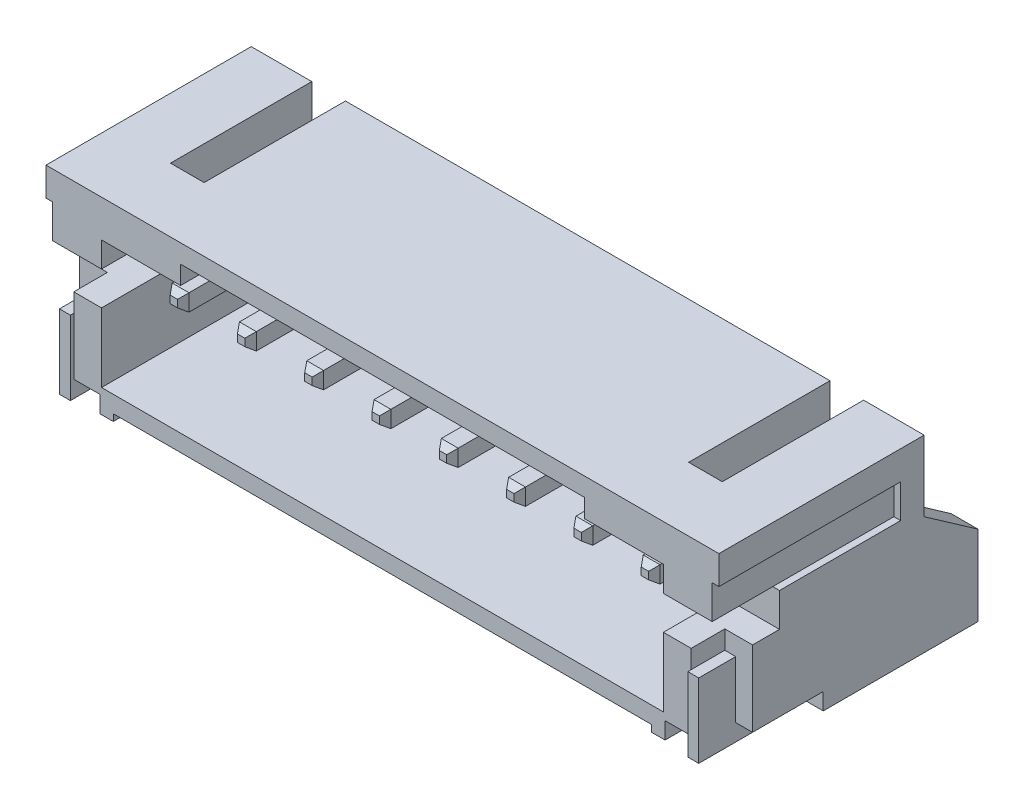
from build123d import *
from OCP.BRepFilletAPI import BRepFilletAPI_MakeChamfer

# Parameters (mm, degrees)
SKETCH_1_W           = 20
SKETCH_1_H           = 5.6
EXTRUDE_1_DEPTH      = 4.8
SKETCH_2_W           = 20
SKETCH_2_H           = 5.6
EXTRUDE_2_DEPTH      = 1.3
SKETCH_3_W           = 0.5
SKETCH_3_H           = 3.439407172
EXTRUDE_3_DEPTH      = 0.5
SKETCH_4_W           = 0.5
SKETCH_4_H           = 0.5
EXTRUDE_4_DEPTH      = 2.2
SKETCH_5_W           = 0.8
SKETCH_5_H           = 3.5
EXTRUDE_5_DEPTH      = 1.6
CHAMFER_1_SIZE       = 1.120332061
CHAMFER_1_SIZE_2     = 1.6
SKETCH_6_W           = 18.4
SKETCH_6_H           = 2
SKETCH_6_W_2         = 3.6
SKETCH_6_H_2         = 1
CUT_EXTRUDE_1_DEPTH  = 0.8
SKETCH_7_W           = 1
SKETCH_7_H           = 1.1
CUT_EXTRUDE_2_DEPTH  = 4.2
SKETCH_8_W           = 0.2
SKETCH_8_H           = 1
CUT_EXTRUDE_3_DEPTH  = 5.4
SKETCH_9_W           = 1.65
SKETCH_9_H           = 1
CUT_EXTRUDE_4_DEPTH  = 1.8
CUT_EXTRUDE_5_DEPTH  = 1
SKETCH_11_W          = 0.5
SKETCH_11_H          = 0.5
CUT_EXTRUDE_6_DEPTH  = 2.1
SKETCH_12_W          = 0.325
SKETCH_12_H          = 2.2
EXTRUDE_6_DEPTH      = 1.1
SKETCH_13_W          = 0.2
SKETCH_13_H          = 2.1
CUT_EXTRUDE_7_DEPTH  = 0.2
SKETCH_14_W          = 0.5
SKETCH_14_H          = 0.5
EXTRUDE_7_DEPTH      = 4
CHAMFER_2_SIZE       = 0.2
CHAMFER_2_SIZE2      = 0.140041508
FILLET_1_R           = 0.4
SKETCH_15_W          = 16
SKETCH_15_H          = 6.1
CUT_EXTRUDE_11_DEPTH = 0.2
FILLET_2_R           = 0.4


# Some blends are built 0.0001 mm under size
with BuildPart() as part:
    # Эскиз1 → Бобышка-Вытянуть1 (new body)
    with BuildSketch(Plane.XY):
        with Locations((0, -0.639407172)):
            Rectangle(SKETCH_1_W, SKETCH_1_H)
        Polygon((-6, 1.610592828), (6, 1.610592828), (6, 1.060592828), (8.35, 1.060592828), (8.35, -2.739407172), (-8.35, -2.739407172), (-8.35, 1.060592828), (-6, 1.060592828), align=None, mode=Mode.SUBTRACT)
    extrude(amount=EXTRUDE_1_DEPTH)

    # Эскиз2 → Бобышка-Вытянуть2 (add)
    with BuildSketch(Plane(origin=(0, 0, 0), x_dir=(-1, 0, 0), z_dir=(0, 0, -1))):
        with Locations((0, -0.639407172)):
            Rectangle(SKETCH_2_W, SKETCH_2_H)
    extrude(amount=EXTRUDE_2_DEPTH)

    # Эскиз3 → Бобышка-Вытянуть3 (add)
    with BuildSketch(Plane(origin=(0, 0, -1.3), x_dir=(-1, 0, 0), z_dir=(0, 0, -1))):
        with Locations((1, -1.719703586)):
            Rectangle(SKETCH_3_W, SKETCH_3_H)
        with Locations((3, -1.719703586)):
            Rectangle(SKETCH_3_W, SKETCH_3_H)
        with Locations((5, -1.719703586)):
            Rectangle(SKETCH_3_W, SKETCH_3_H)
        with Locations((7, -1.719703586)):
            Rectangle(SKETCH_3_W, SKETCH_3_H)
        with Locations((-7, -1.719703586)):
            Rectangle(SKETCH_3_W, SKETCH_3_H)
        with Locations((-5, -1.719703586)):
            Rectangle(SKETCH_3_W, SKETCH_3_H)
        with Locations((-3, -1.719703586)):
            Rectangle(SKETCH_3_W, SKETCH_3_H)
        with Locations((-1, -1.719703586)):
            Rectangle(SKETCH_3_W, SKETCH_3_H)
    extrude(amount=EXTRUDE_3_DEPTH)

    # Эскиз4 → Бобышка-Вытянуть4 (add)
    with BuildSketch(Plane(origin=(0, 0, -1.8), x_dir=(-1, 0, 0), z_dir=(0, 0, -1))):
        with Locations((-7, -3.189407172)):
            Rectangle(SKETCH_4_W, SKETCH_4_H)
        with Locations((-5, -3.189407172)):
            Rectangle(SKETCH_4_W, SKETCH_4_H)
        with Locations((-3, -3.189407172)):
            Rectangle(SKETCH_4_W, SKETCH_4_H)
        with Locations((-1, -3.189407172)):
            Rectangle(SKETCH_4_W, SKETCH_4_H)
        with Locations((1, -3.189407172)):
            Rectangle(SKETCH_4_W, SKETCH_4_H)
        with Locations((3, -3.189407172)):
            Rectangle(SKETCH_4_W, SKETCH_4_H)
        with Locations((5, -3.189407172)):
            Rectangle(SKETCH_4_W, SKETCH_4_H)
        with Locations((7, -3.189407172)):
            Rectangle(SKETCH_4_W, SKETCH_4_H)
    extrude(amount=EXTRUDE_4_DEPTH)

    # Эскиз5 → Бобышка-Вытянуть5 (add)
    with BuildSketch(Plane(origin=(0, 0, -1.3), x_dir=(-1, 0, 0), z_dir=(0, 0, -1))):
        with Locations((-9.6, -1.689407172)):
            Rectangle(SKETCH_5_W, SKETCH_5_H)
        with Locations((9.6, -1.689407172)):
            Rectangle(SKETCH_5_W, SKETCH_5_H)
    extrude(amount=EXTRUDE_5_DEPTH)

    # Фаска1
    chamfer_1_edges_1 = [part.edges().sort_by_distance(p)[0] for p in [
        (-9.6, 0.060592828, -2.9),
    ]]
    chamfer_1_side_1 = [part.faces().sort_by_distance(p)[0] for p in [
        (-9.6, 0.038186187, -2.9),
    ]]
    chamfer_1_edges_2 = [part.edges().sort_by_distance(p)[0] for p in [
        (9.6, 0.060592828, -2.9),
    ]]
    chamfer_1_side_2 = [part.faces().sort_by_distance(p)[0] for p in [
        (9.6, 0.038186187, -2.9),
    ]]
    chamfer_1 = BRepFilletAPI_MakeChamfer(part.part.solid().wrapped)
    for e in chamfer_1_edges_1:
        chamfer_1.Add(CHAMFER_1_SIZE - 0.0001, CHAMFER_1_SIZE_2 - 0.0001, e.wrapped, chamfer_1_side_1[0].wrapped)
    for e in chamfer_1_edges_2:
        chamfer_1.Add(CHAMFER_1_SIZE - 0.0001, CHAMFER_1_SIZE_2 - 0.0001, e.wrapped, chamfer_1_side_2[0].wrapped)
    add(Compound.cast(chamfer_1.Shape()), mode=Mode.REPLACE)  # a hair under: the kernel refuses the full size

    # Эскиз6 → Вырез-Вытянуть1 (cut)
    with BuildSketch(Plane(origin=(0, 0, -1.3), x_dir=(-1, 0, 0), z_dir=(0, 0, -1))):
        with Locations((0, -1.839407172)):
            Rectangle(SKETCH_6_W, SKETCH_6_H)
        with Locations((0, 1.110592828)):
            Rectangle(SKETCH_6_W_2, SKETCH_6_H_2)
    extrude(amount=-CUT_EXTRUDE_1_DEPTH, mode=Mode.SUBTRACT)

    # Эскиз7 → Вырез-Вытянуть2 (cut)
    with BuildSketch(Plane(origin=(0, 0, -1.3), x_dir=(-1, 0, 0), z_dir=(0, 0, -1))):
        with Locations((7.7, 1.610592828)):
            Rectangle(SKETCH_7_W, SKETCH_7_H)
        with Locations((-7.7, 1.610592828)):
            Rectangle(SKETCH_7_W, SKETCH_7_H)
    extrude(amount=-CUT_EXTRUDE_2_DEPTH, mode=Mode.SUBTRACT)

    # Эскиз8 → Вырез-Вытянуть3 (cut)
    with BuildSketch(Plane.XY.offset(4.8)):
        with Locations((9.9, 0.810592828)):
            Rectangle(SKETCH_8_W, SKETCH_8_H)
        with Locations((-9.9, 0.810592828)):
            Rectangle(SKETCH_8_W, SKETCH_8_H)
    extrude(amount=-CUT_EXTRUDE_3_DEPTH, mode=Mode.SUBTRACT)

    # Эскиз9 → Вырез-Вытянуть4 (cut)
    with BuildSketch(Plane.XY.offset(4.8)):
        with Locations((-9.175, -0.189407172)):
            Rectangle(SKETCH_9_W, SKETCH_9_H)
        with Locations((9.175, -0.189407172)):
            Rectangle(SKETCH_9_W, SKETCH_9_H)
    extrude(amount=-CUT_EXTRUDE_4_DEPTH, mode=Mode.SUBTRACT)

    # Эскиз10 → Вырез-Вытянуть5 (cut)
    with BuildSketch(Plane.XY.offset(4.8)):
        Polygon((-10, -0.689407172), (-9.175, -0.689407172), (-9.175, -2.939407172), (-8.4, -2.939407172), (-8.4, -3.439407172), (-9.2, -3.439407172), (-10, -3.439407172), align=None)
        Polygon((10, -0.689407172), (10, -3.439407172), (9.2, -3.439407172), (8.4, -3.439407172), (8.4, -2.939407172), (9.175, -2.939407172), (9.175, -0.689407172), align=None)
    extrude(amount=-CUT_EXTRUDE_5_DEPTH, mode=Mode.SUBTRACT)

    # Эскиз11 → Вырез-Вытянуть6 (cut)
    with BuildSketch(Plane.XY.offset(3.8)):
        with Locations((-9.75, -3.189407172)):
            Rectangle(SKETCH_11_W, SKETCH_11_H)
        with Locations((9.75, -3.189407172)):
            Rectangle(SKETCH_11_W, SKETCH_11_H)
    extrude(amount=-CUT_EXTRUDE_6_DEPTH, mode=Mode.SUBTRACT)

    # Эскиз12 → Бобышка-Вытянуть6 (add)
    with BuildSketch(Plane.XY.offset(3.8)):
        with Locations((-9.3375, -2.339407172)):
            Rectangle(SKETCH_12_W, SKETCH_12_H)
        with Locations((9.3375, -2.339407172)):
            Rectangle(SKETCH_12_W, SKETCH_12_H)
    extrude(amount=EXTRUDE_6_DEPTH)

    # Эскиз13 → Вырез-Вытянуть7 (cut)
    with BuildSketch(Plane.XZ.offset(3.439407172)):
        with Locations((-9.075, 2.75)):
            Rectangle(SKETCH_13_W, SKETCH_13_H)
        with Locations((9.075, 2.75)):
            Rectangle(SKETCH_13_W, SKETCH_13_H)
    extrude(amount=-CUT_EXTRUDE_7_DEPTH, mode=Mode.SUBTRACT)

    # Эскиз14 → Бобышка-Вытянуть7 (add)
    with BuildSketch(Plane.XY):
        with Locations((7, -0.25)):
            Rectangle(SKETCH_14_W, SKETCH_14_H)
        with Locations((5, -0.25)):
            Rectangle(SKETCH_14_W, SKETCH_14_H)
        with Locations((3, -0.25)):
            Rectangle(SKETCH_14_W, SKETCH_14_H)
        with Locations((1, -0.25)):
            Rectangle(SKETCH_14_W, SKETCH_14_H)
        with Locations((-1, -0.25)):
            Rectangle(SKETCH_14_W, SKETCH_14_H)
        with Locations((-3, -0.25)):
            Rectangle(SKETCH_14_W, SKETCH_14_H)
        with Locations((-5, -0.25)):
            Rectangle(SKETCH_14_W, SKETCH_14_H)
        with Locations((-7, -0.25)):
            Rectangle(SKETCH_14_W, SKETCH_14_H)
    extrude(amount=EXTRUDE_7_DEPTH)

    # Фаска2: one chamfer whose edges measure the first distance from different faces: ONE call of the kernel's chamfer builder (chamfer() names one face for all edges)
    chamfer_2_edges_1 = [part.edges().sort_by_distance(p)[0] for p in [
        (7.25, -3.189407172, -4),
    ]]
    chamfer_2_side_1 = [part.faces().sort_by_distance(p)[0] for p in [
        (7.25, -3.395681296, -2.65),
    ]]
    chamfer_2_edges_2 = [part.edges().sort_by_distance(p)[0] for p in [
        (7, -3.439407172, -4),
        (5, -3.439407172, -4),
        (3, -3.439407172, -4),
        (1, -3.439407172, -4),
        (-1, -3.439407172, -4),
        (-3, -3.439407172, -4),
        (-5, -3.439407172, -4),
        (-7, -3.439407172, -4),
    ]]
    chamfer_2_side_2 = [part.faces().sort_by_distance(p)[0] for p in [
        (0, -3.439407172, 1.237305191),
    ]]
    chamfer_2_edges_3 = [part.edges().sort_by_distance(p)[0] for p in [
        (6.75, -3.189407172, -4),
    ]]
    chamfer_2_side_3 = [part.faces().sort_by_distance(p)[0] for p in [
        (6.75, -0.043725875, -1.55),
    ]]
    chamfer_2_edges_4 = [part.edges().sort_by_distance(p)[0] for p in [
        (7, -2.939407172, -4),
    ]]
    chamfer_2_side_4 = [part.faces().sort_by_distance(p)[0] for p in [
        (7, -2.939407172, -2.9),
    ]]
    chamfer_2_edges_5 = [part.edges().sort_by_distance(p)[0] for p in [
        (4.75, -3.189407172, -4),
    ]]
    chamfer_2_side_5 = [part.faces().sort_by_distance(p)[0] for p in [
        (4.75, -0.043725875, -1.55),
    ]]
    chamfer_2_edges_6 = [part.edges().sort_by_distance(p)[0] for p in [
        (5, -2.939407172, -4),
    ]]
    chamfer_2_side_6 = [part.faces().sort_by_distance(p)[0] for p in [
        (5, -2.939407172, -2.9),
    ]]
    chamfer_2_edges_7 = [part.edges().sort_by_distance(p)[0] for p in [
        (5.25, -3.189407172, -4),
    ]]
    chamfer_2_side_7 = [part.faces().sort_by_distance(p)[0] for p in [
        (5.25, -3.395681296, -2.65),
    ]]
    chamfer_2_edges_8 = [part.edges().sort_by_distance(p)[0] for p in [
        (2.75, -3.189407172, -4),
    ]]
    chamfer_2_side_8 = [part.faces().sort_by_distance(p)[0] for p in [
        (2.75, -0.043725875, -1.55),
    ]]
    chamfer_2_edges_9 = [part.edges().sort_by_distance(p)[0] for p in [
        (3, -2.939407172, -4),
    ]]
    chamfer_2_side_9 = [part.faces().sort_by_distance(p)[0] for p in [
        (3, -2.939407172, -2.9),
    ]]
    chamfer_2_edges_10 = [part.edges().sort_by_distance(p)[0] for p in [
        (3.25, -3.189407172, -4),
    ]]
    chamfer_2_side_10 = [part.faces().sort_by_distance(p)[0] for p in [
        (3.25, -3.395681296, -2.65),
    ]]
    chamfer_2_edges_11 = [part.edges().sort_by_distance(p)[0] for p in [
        (0.75, -3.189407172, -4),
    ]]
    chamfer_2_side_11 = [part.faces().sort_by_distance(p)[0] for p in [
        (0.75, -3.395681296, -2.65),
    ]]
    chamfer_2_edges_12 = [part.edges().sort_by_distance(p)[0] for p in [
        (1, -2.939407172, -4),
    ]]
    chamfer_2_side_12 = [part.faces().sort_by_distance(p)[0] for p in [
        (1, -2.939407172, -2.9),
    ]]
    chamfer_2_edges_13 = [part.edges().sort_by_distance(p)[0] for p in [
        (1.25, -3.189407172, -4),
    ]]
    chamfer_2_side_13 = [part.faces().sort_by_distance(p)[0] for p in [
        (1.25, -0.043725875, -1.55),
    ]]
    chamfer_2_edges_14 = [part.edges().sort_by_distance(p)[0] for p in [
        (-1.25, -3.189407172, -4),
    ]]
    chamfer_2_side_14 = [part.faces().sort_by_distance(p)[0] for p in [
        (-1.25, -0.043725875, -1.55),
    ]]
    chamfer_2_edges_15 = [part.edges().sort_by_distance(p)[0] for p in [
        (-1, -2.939407172, -4),
    ]]
    chamfer_2_side_15 = [part.faces().sort_by_distance(p)[0] for p in [
        (-1, -2.939407172, -2.9),
    ]]
    chamfer_2_edges_16 = [part.edges().sort_by_distance(p)[0] for p in [
        (-0.75, -3.189407172, -4),
    ]]
    chamfer_2_side_16 = [part.faces().sort_by_distance(p)[0] for p in [
        (-0.75, -3.395681296, -2.65),
    ]]
    chamfer_2_edges_17 = [part.edges().sort_by_distance(p)[0] for p in [
        (-3.25, -3.189407172, -4),
    ]]
    chamfer_2_side_17 = [part.faces().sort_by_distance(p)[0] for p in [
        (-3.25, -3.395681296, -2.65),
    ]]
    chamfer_2_edges_18 = [part.edges().sort_by_distance(p)[0] for p in [
        (-3, -2.939407172, -4),
    ]]
    chamfer_2_side_18 = [part.faces().sort_by_distance(p)[0] for p in [
        (-3, -2.939407172, -2.9),
    ]]
    chamfer_2_edges_19 = [part.edges().sort_by_distance(p)[0] for p in [
        (-2.75, -3.189407172, -4),
    ]]
    chamfer_2_side_19 = [part.faces().sort_by_distance(p)[0] for p in [
        (-2.75, -0.043725875, -1.55),
    ]]
    chamfer_2_edges_20 = [part.edges().sort_by_distance(p)[0] for p in [
        (-5.25, -3.189407172, -4),
    ]]
    chamfer_2_side_20 = [part.faces().sort_by_distance(p)[0] for p in [
        (-5.25, -3.395681296, -2.65),
    ]]
    chamfer_2_edges_21 = [part.edges().sort_by_distance(p)[0] for p in [
        (-5, -2.939407172, -4),
    ]]
    chamfer_2_side_21 = [part.faces().sort_by_distance(p)[0] for p in [
        (-5, -2.939407172, -2.9),
    ]]
    chamfer_2_edges_22 = [part.edges().sort_by_distance(p)[0] for p in [
        (-4.75, -3.189407172, -4),
    ]]
    chamfer_2_side_22 = [part.faces().sort_by_distance(p)[0] for p in [
        (-4.75, -0.043725875, -1.55),
    ]]
    chamfer_2_edges_23 = [part.edges().sort_by_distance(p)[0] for p in [
        (-7.25, -3.189407172, -4),
    ]]
    chamfer_2_side_23 = [part.faces().sort_by_distance(p)[0] for p in [
        (-7.25, -3.395681296, -2.65),
    ]]
    chamfer_2_edges_24 = [part.edges().sort_by_distance(p)[0] for p in [
        (-7, -2.939407172, -4),
    ]]
    chamfer_2_side_24 = [part.faces().sort_by_distance(p)[0] for p in [
        (-7, -2.939407172, -2.9),
    ]]
    chamfer_2_edges_25 = [part.edges().sort_by_distance(p)[0] for p in [
        (-6.75, -3.189407172, -4),
    ]]
    chamfer_2_side_25 = [part.faces().sort_by_distance(p)[0] for p in [
        (-6.75, -0.043725875, -1.55),
    ]]
    chamfer_2_edges_26 = [part.edges().sort_by_distance(p)[0] for p in [
        (7.25, -0.25, 4),
    ]]
    chamfer_2_side_26 = [part.faces().sort_by_distance(p)[0] for p in [
        (7.25, -0.25, 2),
    ]]
    chamfer_2_edges_27 = [part.edges().sort_by_distance(p)[0] for p in [
        (7, 0, 4),
    ]]
    chamfer_2_side_27 = [part.faces().sort_by_distance(p)[0] for p in [
        (7, 0, 2),
    ]]
    chamfer_2_edges_28 = [part.edges().sort_by_distance(p)[0] for p in [
        (6.75, -0.25, 4),
    ]]
    chamfer_2_side_28 = [part.faces().sort_by_distance(p)[0] for p in [
        (6.75, -0.25, 2),
    ]]
    chamfer_2_edges_29 = [part.edges().sort_by_distance(p)[0] for p in [
        (7, -0.5, 4),
    ]]
    chamfer_2_side_29 = [part.faces().sort_by_distance(p)[0] for p in [
        (7, -0.5, 2),
    ]]
    chamfer_2_edges_30 = [part.edges().sort_by_distance(p)[0] for p in [
        (5.25, -0.25, 4),
    ]]
    chamfer_2_side_30 = [part.faces().sort_by_distance(p)[0] for p in [
        (5.25, -0.25, 2),
    ]]
    chamfer_2_edges_31 = [part.edges().sort_by_distance(p)[0] for p in [
        (5, 0, 4),
    ]]
    chamfer_2_side_31 = [part.faces().sort_by_distance(p)[0] for p in [
        (5, 0, 2),
    ]]
    chamfer_2_edges_32 = [part.edges().sort_by_distance(p)[0] for p in [
        (4.75, -0.25, 4),
    ]]
    chamfer_2_side_32 = [part.faces().sort_by_distance(p)[0] for p in [
        (4.75, -0.25, 2),
    ]]
    chamfer_2_edges_33 = [part.edges().sort_by_distance(p)[0] for p in [
        (5, -0.5, 4),
    ]]
    chamfer_2_side_33 = [part.faces().sort_by_distance(p)[0] for p in [
        (5, -0.5, 2),
    ]]
    chamfer_2_edges_34 = [part.edges().sort_by_distance(p)[0] for p in [
        (3.25, -0.25, 4),
    ]]
    chamfer_2_side_34 = [part.faces().sort_by_distance(p)[0] for p in [
        (3.25, -0.25, 2),
    ]]
    chamfer_2_edges_35 = [part.edges().sort_by_distance(p)[0] for p in [
        (3, 0, 4),
    ]]
    chamfer_2_side_35 = [part.faces().sort_by_distance(p)[0] for p in [
        (3, 0, 2),
    ]]
    chamfer_2_edges_36 = [part.edges().sort_by_distance(p)[0] for p in [
        (2.75, -0.25, 4),
    ]]
    chamfer_2_side_36 = [part.faces().sort_by_distance(p)[0] for p in [
        (2.75, -0.25, 2),
    ]]
    chamfer_2_edges_37 = [part.edges().sort_by_distance(p)[0] for p in [
        (3, -0.5, 4),
    ]]
    chamfer_2_side_37 = [part.faces().sort_by_distance(p)[0] for p in [
        (3, -0.5, 2),
    ]]
    chamfer_2_edges_38 = [part.edges().sort_by_distance(p)[0] for p in [
        (1.25, -0.25, 4),
    ]]
    chamfer_2_side_38 = [part.faces().sort_by_distance(p)[0] for p in [
        (1.25, -0.25, 2),
    ]]
    chamfer_2_edges_39 = [part.edges().sort_by_distance(p)[0] for p in [
        (1, 0, 4),
    ]]
    chamfer_2_side_39 = [part.faces().sort_by_distance(p)[0] for p in [
        (1, 0, 2),
    ]]
    chamfer_2_edges_40 = [part.edges().sort_by_distance(p)[0] for p in [
        (0.75, -0.25, 4),
    ]]
    chamfer_2_side_40 = [part.faces().sort_by_distance(p)[0] for p in [
        (0.75, -0.25, 2),
    ]]
    chamfer_2_edges_41 = [part.edges().sort_by_distance(p)[0] for p in [
        (1, -0.5, 4),
    ]]
    chamfer_2_side_41 = [part.faces().sort_by_distance(p)[0] for p in [
        (1, -0.5, 2),
    ]]
    chamfer_2_edges_42 = [part.edges().sort_by_distance(p)[0] for p in [
        (-0.75, -0.25, 4),
    ]]
    chamfer_2_side_42 = [part.faces().sort_by_distance(p)[0] for p in [
        (-0.75, -0.25, 2),
    ]]
    chamfer_2_edges_43 = [part.edges().sort_by_distance(p)[0] for p in [
        (-1, 0, 4),
    ]]
    chamfer_2_side_43 = [part.faces().sort_by_distance(p)[0] for p in [
        (-1, 0, 2),
    ]]
    chamfer_2_edges_44 = [part.edges().sort_by_distance(p)[0] for p in [
        (-1.25, -0.25, 4),
    ]]
    chamfer_2_side_44 = [part.faces().sort_by_distance(p)[0] for p in [
        (-1.25, -0.25, 2),
    ]]
    chamfer_2_edges_45 = [part.edges().sort_by_distance(p)[0] for p in [
        (-1, -0.5, 4),
    ]]
    chamfer_2_side_45 = [part.faces().sort_by_distance(p)[0] for p in [
        (-1, -0.5, 2),
    ]]
    chamfer_2_edges_46 = [part.edges().sort_by_distance(p)[0] for p in [
        (-2.75, -0.25, 4),
    ]]
    chamfer_2_side_46 = [part.faces().sort_by_distance(p)[0] for p in [
        (-2.75, -0.25, 2),
    ]]
    chamfer_2_edges_47 = [part.edges().sort_by_distance(p)[0] for p in [
        (-3, 0, 4),
    ]]
    chamfer_2_side_47 = [part.faces().sort_by_distance(p)[0] for p in [
        (-3, 0, 2),
    ]]
    chamfer_2_edges_48 = [part.edges().sort_by_distance(p)[0] for p in [
        (-3.25, -0.25, 4),
    ]]
    chamfer_2_side_48 = [part.faces().sort_by_distance(p)[0] for p in [
        (-3.25, -0.25, 2),
    ]]
    chamfer_2_edges_49 = [part.edges().sort_by_distance(p)[0] for p in [
        (-3, -0.5, 4),
    ]]
    chamfer_2_side_49 = [part.faces().sort_by_distance(p)[0] for p in [
        (-3, -0.5, 2),
    ]]
    chamfer_2_edges_50 = [part.edges().sort_by_distance(p)[0] for p in [
        (-4.75, -0.25, 4),
    ]]
    chamfer_2_side_50 = [part.faces().sort_by_distance(p)[0] for p in [
        (-4.75, -0.25, 2),
    ]]
    chamfer_2_edges_51 = [part.edges().sort_by_distance(p)[0] for p in [
        (-5, 0, 4),
    ]]
    chamfer_2_side_51 = [part.faces().sort_by_distance(p)[0] for p in [
        (-5, 0, 2),
    ]]
    chamfer_2_edges_52 = [part.edges().sort_by_distance(p)[0] for p in [
        (-5.25, -0.25, 4),
    ]]
    chamfer_2_side_52 = [part.faces().sort_by_distance(p)[0] for p in [
        (-5.25, -0.25, 2),
    ]]
    chamfer_2_edges_53 = [part.edges().sort_by_distance(p)[0] for p in [
        (-5, -0.5, 4),
    ]]
    chamfer_2_side_53 = [part.faces().sort_by_distance(p)[0] for p in [
        (-5, -0.5, 2),
    ]]
    chamfer_2_edges_54 = [part.edges().sort_by_distance(p)[0] for p in [
        (-6.75, -0.25, 4),
    ]]
    chamfer_2_side_54 = [part.faces().sort_by_distance(p)[0] for p in [
        (-6.75, -0.25, 2),
    ]]
    chamfer_2_edges_55 = [part.edges().sort_by_distance(p)[0] for p in [
        (-7, 0, 4),
    ]]
    chamfer_2_side_55 = [part.faces().sort_by_distance(p)[0] for p in [
        (-7, 0, 2),
    ]]
    chamfer_2_edges_56 = [part.edges().sort_by_distance(p)[0] for p in [
        (-7.25, -0.25, 4),
    ]]
    chamfer_2_side_56 = [part.faces().sort_by_distance(p)[0] for p in [
        (-7.25, -0.25, 2),
    ]]
    chamfer_2_edges_57 = [part.edges().sort_by_distance(p)[0] for p in [
        (-7, -0.5, 4),
    ]]
    chamfer_2_side_57 = [part.faces().sort_by_distance(p)[0] for p in [
        (-7, -0.5, 2),
    ]]
    chamfer_2 = BRepFilletAPI_MakeChamfer(part.part.solid().wrapped)
    for e in chamfer_2_edges_1:
        chamfer_2.Add(CHAMFER_2_SIZE, CHAMFER_2_SIZE2, e.wrapped, chamfer_2_side_1[0].wrapped)  # the first distance lies on this face
    for e in chamfer_2_edges_2:
        chamfer_2.Add(CHAMFER_2_SIZE, CHAMFER_2_SIZE2, e.wrapped, chamfer_2_side_2[0].wrapped)  # the first distance lies on this face
    for e in chamfer_2_edges_3:
        chamfer_2.Add(CHAMFER_2_SIZE, CHAMFER_2_SIZE2, e.wrapped, chamfer_2_side_3[0].wrapped)  # the first distance lies on this face
    for e in chamfer_2_edges_4:
        chamfer_2.Add(CHAMFER_2_SIZE, CHAMFER_2_SIZE2, e.wrapped, chamfer_2_side_4[0].wrapped)  # the first distance lies on this face
    for e in chamfer_2_edges_5:
        chamfer_2.Add(CHAMFER_2_SIZE, CHAMFER_2_SIZE2, e.wrapped, chamfer_2_side_5[0].wrapped)  # the first distance lies on this face
    for e in chamfer_2_edges_6:
        chamfer_2.Add(CHAMFER_2_SIZE, CHAMFER_2_SIZE2, e.wrapped, chamfer_2_side_6[0].wrapped)  # the first distance lies on this face
    for e in chamfer_2_edges_7:
        chamfer_2.Add(CHAMFER_2_SIZE, CHAMFER_2_SIZE2, e.wrapped, chamfer_2_side_7[0].wrapped)  # the first distance lies on this face
    for e in chamfer_2_edges_8:
        chamfer_2.Add(CHAMFER_2_SIZE, CHAMFER_2_SIZE2, e.wrapped, chamfer_2_side_8[0].wrapped)  # the first distance lies on this face
    for e in chamfer_2_edges_9:
        chamfer_2.Add(CHAMFER_2_SIZE, CHAMFER_2_SIZE2, e.wrapped, chamfer_2_side_9[0].wrapped)  # the first distance lies on this face
    for e in chamfer_2_edges_10:
        chamfer_2.Add(CHAMFER_2_SIZE, CHAMFER_2_SIZE2, e.wrapped, chamfer_2_side_10[0].wrapped)  # the first distance lies on this face
    for e in chamfer_2_edges_11:
        chamfer_2.Add(CHAMFER_2_SIZE, CHAMFER_2_SIZE2, e.wrapped, chamfer_2_side_11[0].wrapped)  # the first distance lies on this face
    for e in chamfer_2_edges_12:
        chamfer_2.Add(CHAMFER_2_SIZE, CHAMFER_2_SIZE2, e.wrapped, chamfer_2_side_12[0].wrapped)  # the first distance lies on this face
    for e in chamfer_2_edges_13:
        chamfer_2.Add(CHAMFER_2_SIZE, CHAMFER_2_SIZE2, e.wrapped, chamfer_2_side_13[0].wrapped)  # the first distance lies on this face
    for e in chamfer_2_edges_14:
        chamfer_2.Add(CHAMFER_2_SIZE, CHAMFER_2_SIZE2, e.wrapped, chamfer_2_side_14[0].wrapped)  # the first distance lies on this face
    for e in chamfer_2_edges_15:
        chamfer_2.Add(CHAMFER_2_SIZE, CHAMFER_2_SIZE2, e.wrapped, chamfer_2_side_15[0].wrapped)  # the first distance lies on this face
    for e in chamfer_2_edges_16:
        chamfer_2.Add(CHAMFER_2_SIZE, CHAMFER_2_SIZE2, e.wrapped, chamfer_2_side_16[0].wrapped)  # the first distance lies on this face
    for e in chamfer_2_edges_17:
        chamfer_2.Add(CHAMFER_2_SIZE, CHAMFER_2_SIZE2, e.wrapped, chamfer_2_side_17[0].wrapped)  # the first distance lies on this face
    for e in chamfer_2_edges_18:
        chamfer_2.Add(CHAMFER_2_SIZE, CHAMFER_2_SIZE2, e.wrapped, chamfer_2_side_18[0].wrapped)  # the first distance lies on this face
    for e in chamfer_2_edges_19:
        chamfer_2.Add(CHAMFER_2_SIZE, CHAMFER_2_SIZE2, e.wrapped, chamfer_2_side_19[0].wrapped)  # the first distance lies on this face
    for e in chamfer_2_edges_20:
        chamfer_2.Add(CHAMFER_2_SIZE, CHAMFER_2_SIZE2, e.wrapped, chamfer_2_side_20[0].wrapped)  # the first distance lies on this face
    for e in chamfer_2_edges_21:
        chamfer_2.Add(CHAMFER_2_SIZE, CHAMFER_2_SIZE2, e.wrapped, chamfer_2_side_21[0].wrapped)  # the first distance lies on this face
    for e in chamfer_2_edges_22:
        chamfer_2.Add(CHAMFER_2_SIZE, CHAMFER_2_SIZE2, e.wrapped, chamfer_2_side_22[0].wrapped)  # the first distance lies on this face
    for e in chamfer_2_edges_23:
        chamfer_2.Add(CHAMFER_2_SIZE, CHAMFER_2_SIZE2, e.wrapped, chamfer_2_side_23[0].wrapped)  # the first distance lies on this face
    for e in chamfer_2_edges_24:
        chamfer_2.Add(CHAMFER_2_SIZE, CHAMFER_2_SIZE2, e.wrapped, chamfer_2_side_24[0].wrapped)  # the first distance lies on this face
    for e in chamfer_2_edges_25:
        chamfer_2.Add(CHAMFER_2_SIZE, CHAMFER_2_SIZE2, e.wrapped, chamfer_2_side_25[0].wrapped)  # the first distance lies on this face
    for e in chamfer_2_edges_26:
        chamfer_2.Add(CHAMFER_2_SIZE, CHAMFER_2_SIZE2, e.wrapped, chamfer_2_side_26[0].wrapped)  # the first distance lies on this face
    for e in chamfer_2_edges_27:
        chamfer_2.Add(CHAMFER_2_SIZE, CHAMFER_2_SIZE2, e.wrapped, chamfer_2_side_27[0].wrapped)  # the first distance lies on this face
    for e in chamfer_2_edges_28:
        chamfer_2.Add(CHAMFER_2_SIZE, CHAMFER_2_SIZE2, e.wrapped, chamfer_2_side_28[0].wrapped)  # the first distance lies on this face
    for e in chamfer_2_edges_29:
        chamfer_2.Add(CHAMFER_2_SIZE, CHAMFER_2_SIZE2, e.wrapped, chamfer_2_side_29[0].wrapped)  # the first distance lies on this face
    for e in chamfer_2_edges_30:
        chamfer_2.Add(CHAMFER_2_SIZE, CHAMFER_2_SIZE2, e.wrapped, chamfer_2_side_30[0].wrapped)  # the first distance lies on this face
    for e in chamfer_2_edges_31:
        chamfer_2.Add(CHAMFER_2_SIZE, CHAMFER_2_SIZE2, e.wrapped, chamfer_2_side_31[0].wrapped)  # the first distance lies on this face
    for e in chamfer_2_edges_32:
        chamfer_2.Add(CHAMFER_2_SIZE, CHAMFER_2_SIZE2, e.wrapped, chamfer_2_side_32[0].wrapped)  # the first distance lies on this face
    for e in chamfer_2_edges_33:
        chamfer_2.Add(CHAMFER_2_SIZE, CHAMFER_2_SIZE2, e.wrapped, chamfer_2_side_33[0].wrapped)  # the first distance lies on this face
    for e in chamfer_2_edges_34:
        chamfer_2.Add(CHAMFER_2_SIZE, CHAMFER_2_SIZE2, e.wrapped, chamfer_2_side_34[0].wrapped)  # the first distance lies on this face
    for e in chamfer_2_edges_35:
        chamfer_2.Add(CHAMFER_2_SIZE, CHAMFER_2_SIZE2, e.wrapped, chamfer_2_side_35[0].wrapped)  # the first distance lies on this face
    for e in chamfer_2_edges_36:
        chamfer_2.Add(CHAMFER_2_SIZE, CHAMFER_2_SIZE2, e.wrapped, chamfer_2_side_36[0].wrapped)  # the first distance lies on this face
    for e in chamfer_2_edges_37:
        chamfer_2.Add(CHAMFER_2_SIZE, CHAMFER_2_SIZE2, e.wrapped, chamfer_2_side_37[0].wrapped)  # the first distance lies on this face
    for e in chamfer_2_edges_38:
        chamfer_2.Add(CHAMFER_2_SIZE, CHAMFER_2_SIZE2, e.wrapped, chamfer_2_side_38[0].wrapped)  # the first distance lies on this face
    for e in chamfer_2_edges_39:
        chamfer_2.Add(CHAMFER_2_SIZE, CHAMFER_2_SIZE2, e.wrapped, chamfer_2_side_39[0].wrapped)  # the first distance lies on this face
    for e in chamfer_2_edges_40:
        chamfer_2.Add(CHAMFER_2_SIZE, CHAMFER_2_SIZE2, e.wrapped, chamfer_2_side_40[0].wrapped)  # the first distance lies on this face
    for e in chamfer_2_edges_41:
        chamfer_2.Add(CHAMFER_2_SIZE, CHAMFER_2_SIZE2, e.wrapped, chamfer_2_side_41[0].wrapped)  # the first distance lies on this face
    for e in chamfer_2_edges_42:
        chamfer_2.Add(CHAMFER_2_SIZE, CHAMFER_2_SIZE2, e.wrapped, chamfer_2_side_42[0].wrapped)  # the first distance lies on this face
    for e in chamfer_2_edges_43:
        chamfer_2.Add(CHAMFER_2_SIZE, CHAMFER_2_SIZE2, e.wrapped, chamfer_2_side_43[0].wrapped)  # the first distance lies on this face
    for e in chamfer_2_edges_44:
        chamfer_2.Add(CHAMFER_2_SIZE, CHAMFER_2_SIZE2, e.wrapped, chamfer_2_side_44[0].wrapped)  # the first distance lies on this face
    for e in chamfer_2_edges_45:
        chamfer_2.Add(CHAMFER_2_SIZE, CHAMFER_2_SIZE2, e.wrapped, chamfer_2_side_45[0].wrapped)  # the first distance lies on this face
    for e in chamfer_2_edges_46:
        chamfer_2.Add(CHAMFER_2_SIZE, CHAMFER_2_SIZE2, e.wrapped, chamfer_2_side_46[0].wrapped)  # the first distance lies on this face
    for e in chamfer_2_edges_47:
        chamfer_2.Add(CHAMFER_2_SIZE, CHAMFER_2_SIZE2, e.wrapped, chamfer_2_side_47[0].wrapped)  # the first distance lies on this face
    for e in chamfer_2_edges_48:
        chamfer_2.Add(CHAMFER_2_SIZE, CHAMFER_2_SIZE2, e.wrapped, chamfer_2_side_48[0].wrapped)  # the first distance lies on this face
    for e in chamfer_2_edges_49:
        chamfer_2.Add(CHAMFER_2_SIZE, CHAMFER_2_SIZE2, e.wrapped, chamfer_2_side_49[0].wrapped)  # the first distance lies on this face
    for e in chamfer_2_edges_50:
        chamfer_2.Add(CHAMFER_2_SIZE, CHAMFER_2_SIZE2, e.wrapped, chamfer_2_side_50[0].wrapped)  # the first distance lies on this face
    for e in chamfer_2_edges_51:
        chamfer_2.Add(CHAMFER_2_SIZE, CHAMFER_2_SIZE2, e.wrapped, chamfer_2_side_51[0].wrapped)  # the first distance lies on this face
    for e in chamfer_2_edges_52:
        chamfer_2.Add(CHAMFER_2_SIZE, CHAMFER_2_SIZE2, e.wrapped, chamfer_2_side_52[0].wrapped)  # the first distance lies on this face
    for e in chamfer_2_edges_53:
        chamfer_2.Add(CHAMFER_2_SIZE, CHAMFER_2_SIZE2, e.wrapped, chamfer_2_side_53[0].wrapped)  # the first distance lies on this face
    for e in chamfer_2_edges_54:
        chamfer_2.Add(CHAMFER_2_SIZE, CHAMFER_2_SIZE2, e.wrapped, chamfer_2_side_54[0].wrapped)  # the first distance lies on this face
    for e in chamfer_2_edges_55:
        chamfer_2.Add(CHAMFER_2_SIZE, CHAMFER_2_SIZE2, e.wrapped, chamfer_2_side_55[0].wrapped)  # the first distance lies on this face
    for e in chamfer_2_edges_56:
        chamfer_2.Add(CHAMFER_2_SIZE, CHAMFER_2_SIZE2, e.wrapped, chamfer_2_side_56[0].wrapped)  # the first distance lies on this face
    for e in chamfer_2_edges_57:
        chamfer_2.Add(CHAMFER_2_SIZE, CHAMFER_2_SIZE2, e.wrapped, chamfer_2_side_57[0].wrapped)  # the first distance lies on this face
    add(Compound.cast(chamfer_2.Shape()), mode=Mode.REPLACE)

    # Скругление1
    fillet_1_edges = [part.edges().sort_by_distance(p)[0] for p in [
        (7, 0, -1.8),
        (5, 0, -1.8),
        (3, 0, -1.8),
        (1, 0, -1.8),
        (7, -2.939407172, -1.8),
        (5, -2.939407172, -1.8),
        (3, -2.939407172, -1.8),
        (1, -2.939407172, -1.8),
        (-1, -2.939407172, -1.8),
        (-3, -2.939407172, -1.8),
        (-5, -2.939407172, -1.8),
        (-7, -2.939407172, -1.8),
        (-1, 0, -1.8),
        (-3, 0, -1.8),
        (-5, 0, -1.8),
        (-7, 0, -1.8),
    ]]
    fillet(fillet_1_edges, radius=FILLET_1_R)

    # Эскиз15 → Вырез-Вытянуть11 (cut)
    with BuildSketch(Plane.XZ.offset(3.439407172)):
        with Locations((0, 1.75)):
            Rectangle(SKETCH_15_W, SKETCH_15_H)
    extrude(amount=-CUT_EXTRUDE_11_DEPTH, mode=Mode.SUBTRACT)

    # Скругление2
    # the kernel refuses this fillet: 0.4 mm, written as the material it takes off along each edge
    with BuildSketch(Plane(origin=(-8.116025404, -3.439407172, -1.3), x_dir=(0, 0, -1), z_dir=(1, 0, 0))) as fillet_2_piece_1:
        with BuildLine():
            CenterArc((0.346410162, 0.4), FILLET_2_R, 210, 60)
            Line((0, 0.2), (0, 0))
            Line((0, 0), (0.346410162, 0))
        make_face()
    extrude(amount=2.232050808, mode=Mode.SUBTRACT)
    with BuildSketch(Plane(origin=(-6.116025404, -3.439407172, -1.3), x_dir=(0, 1, 0), z_dir=(1, 0, 0)), Plane(origin=(-4.116025404, -3.439407172, -1.3), x_dir=(0, 1, 0), z_dir=(1, 0, 0)), Plane(origin=(-2.116025404, -3.439407172, -1.3), x_dir=(0, 1, 0), z_dir=(1, 0, 0)), Plane(origin=(-0.116025404, -3.439407172, -1.3), x_dir=(0, 1, 0), z_dir=(1, 0, 0)), Plane(origin=(1.883974596, -3.439407172, -1.3), x_dir=(0, 1, 0), z_dir=(1, 0, 0)), Plane(origin=(3.883974596, -3.439407172, -1.3), x_dir=(0, 1, 0), z_dir=(1, 0, 0)), Plane(origin=(5.883974596, -3.439407172, -1.3), x_dir=(0, 1, 0), z_dir=(1, 0, 0))) as fillet_2_piece_2:
        with BuildLine():
            CenterArc((0.4, -0.346410162), FILLET_2_R, 120, 60)
            Line((0, -0.346410162), (0, 0))
            Line((0, 0), (0.2, 0))
        make_face()
    extrude(amount=2.232050808, mode=Mode.SUBTRACT)


solid = part.part
